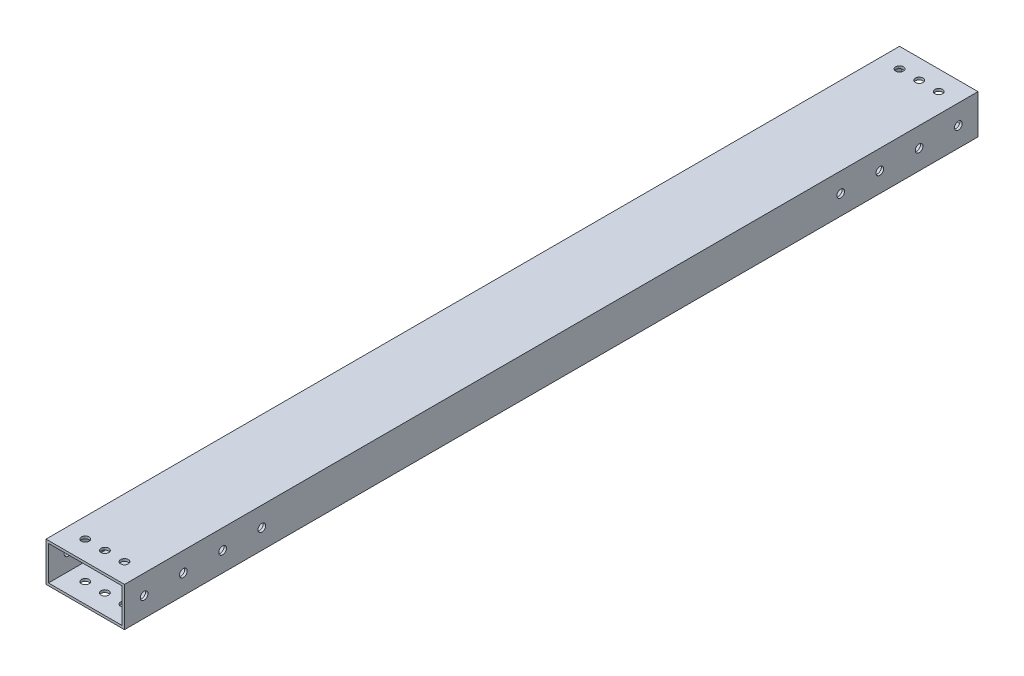
from build123d import *

# Parameters (mm, degrees)
SKETCH1_W           = 50.8
SKETCH1_H           = 25.4
SKETCH1_W_2         = 47.625
SKETCH1_H_2         = 22.225
BOSS_EXTRUDE1_DEPTH = 276.225
SKETCH2_R           = 2.4892
CUT_EXTRUDE1_DEPTH  = 279.550840288
SKETCH3_R           = 2.4892
CUT_EXTRUDE2_DEPTH  = 282.144412402


with BuildPart() as part:
    # Sketch1 → Boss-Extrude1 (new, symmetric)
    with BuildSketch(Plane.XY):
        Rectangle(SKETCH1_W, SKETCH1_H)
        Rectangle(SKETCH1_W_2, SKETCH1_H_2, mode=Mode.SUBTRACT)
    extrude(amount=BOSS_EXTRUDE1_DEPTH, both=True)

    # Sketch2 → Cut-Extrude1 (cut, through all)
    with BuildSketch(Plane(origin=(0, 12.7, 0), x_dir=(1, 0, 0), z_dir=(0, 1, 0))):
        with Locations((-12.7, 263.525)):
            Circle(SKETCH2_R)
        with Locations((0, 263.525)):
            Circle(SKETCH2_R)
        with Locations((12.7, 263.525)):
            Circle(SKETCH2_R)
        with Locations((12.7, -263.525)):
            Circle(SKETCH2_R)
        with Locations((0, -263.525)):
            Circle(SKETCH2_R)
        with Locations((-12.7, -263.525)):
            Circle(SKETCH2_R)
    extrude(amount=-CUT_EXTRUDE1_DEPTH, mode=Mode.SUBTRACT)

    # Sketch3 → Cut-Extrude2 (cut, through all)
    with BuildSketch(Plane(origin=(25.4, 0, 0), x_dir=(0, 0, -1), z_dir=(1, 0, 0))):
        with Locations((263.525, 0)):
            Circle(SKETCH3_R)
        with Locations((-263.525, 0)):
            Circle(SKETCH3_R)
        with Locations((238.125, 0)):
            Circle(SKETCH3_R)
        with Locations((212.725, 0)):
            Circle(SKETCH3_R)
        with Locations((187.325, 0)):
            Circle(SKETCH3_R)
        with Locations((-187.325, 0)):
            Circle(SKETCH3_R)
        with Locations((-212.725, 0)):
            Circle(SKETCH3_R)
        with Locations((-238.125, 0)):
            Circle(SKETCH3_R)
    extrude(amount=-CUT_EXTRUDE2_DEPTH, mode=Mode.SUBTRACT)


solid = part.part
